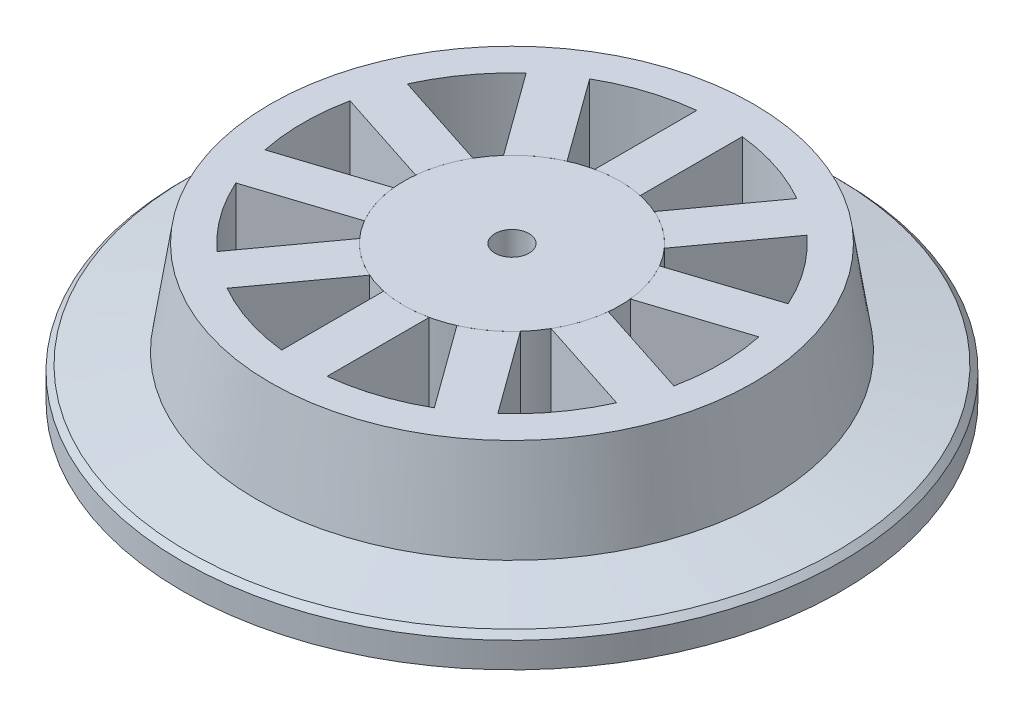
from build123d import *

# Parameters (mm, degrees)
SKETCH_4_R               = 11.6
SKETCH_4_R_2             = 0.6
EXTRUDE_1_DEPTH          = 1.1
EXTRUDE_START            = 1.5
SKETCH_4_3_R             = 9
SKETCH_4_3_R_2           = 0.6
EXTRUDE_2_DEPTH          = 3.3
CHAMFER_1_SIZE           = 0.2
SKETCH_4_4_R             = 0.6
CUT_EXTRUDE_2_DEPTH      = 18.092688495
CHAMFER_2_SIZE           = 0.5
CHAMFER_2_SIZE_2         = 3.3
CUT_EXTRUDE_4_DEPTH      = 18.092688495
EXTRUDE_3_DEPTH          = 4.8
PATTERN_CIRCULAR_2_COUNT = 10


with BuildPart() as part:
    # 草图4 → 凸台-拉伸1 (new body)
    with BuildSketch(Plane(origin=(0, 0, 0), x_dir=(1, 0, 0), z_dir=(0, 1, 0))):
        with Locations(Location((0, 0, 0), (0, 0, 270))):
            Circle(SKETCH_4_R)
        with Locations(Location((0, 0, 0), (0, 0, 270))):
            Circle(SKETCH_4_R_2, mode=Mode.SUBTRACT)
    extrude(amount=EXTRUDE_1_DEPTH)

    # 倒角1
    chamfer_1_edges = [part.edges().sort_by_distance(p)[0] for p in [
        (0, 1.1, -11.6),
    ]]
    chamfer(chamfer_1_edges, length=CHAMFER_1_SIZE)


with BuildPart() as body_2:
    # 草图4<3> → 凸台-拉伸2 (new body)
    with BuildSketch(Plane(origin=(0, 0, 0), x_dir=(1, 0, 0), z_dir=(0, 1, 0)).offset(EXTRUDE_START)):
        with Locations(Location((0, 0, 0), (0, 0, 270))):
            Circle(SKETCH_4_3_R)
        with Locations(Location((0, 0, 0), (0, 0, 270))):
            Circle(SKETCH_4_3_R_2, mode=Mode.SUBTRACT)
    extrude(amount=EXTRUDE_2_DEPTH)


    add(part.part)  # loft_1 joins it to this body
    # loft up to a face of the part (loft_1)
    loft([Face(Wire([body_2.edges().sort_by_distance((-6.560717647, 1.5, -6.160923953))[0]])), Face(Wire([body_2.edges().sort_by_distance((8.310242353, 1.1, -7.803837008))[0]]))])

    # 草图4<4> → 切除-拉伸2 (cut, through all)
    with BuildSketch(Plane(origin=(0, 0, 0), x_dir=(1, 0, 0), z_dir=(0, 1, 0))):
        with Locations(Location((0, 0, 0), (0, 0, 270))):
            Circle(SKETCH_4_4_R)
    extrude(amount=CUT_EXTRUDE_2_DEPTH, mode=Mode.SUBTRACT)

    # 倒角2
    # the kernel refuses this chamfer: 3.3, 0.5 mm, written as the material it takes off along each edge
    with BuildSketch(Plane(origin=(0, 4.8, 0), x_dir=(0, 0, 1), z_dir=(-1, 0, 0))) as chamfer_2_piece_1:
        Polygon((9 - CHAMFER_2_SIZE, 0), (9, -CHAMFER_2_SIZE_2), (9, 0), align=None)
    revolve(axis=Axis((0, 4.8, 0), (0, 1, 0)), mode=Mode.SUBTRACT)

    # 草图5 → 切除-拉伸4 (cut, through all)
    with BuildSketch(Plane(origin=(0, 4.8, 0), x_dir=(1, 0, 0), z_dir=(0, 1, 0))):
        with BuildLine():
            ThreePointArc((3.8, 0), (-2.387467277, -2.9563491), (-0.8, 3.714835124))
            Line((-0.8, 3.714835124), (-0.8, 7.30633287))
            ThreePointArc((-0.8, 7.30633287), (-4.906246019, -5.47277352), (7.35, 0))
            ThreePointArc((7.35, 0), (5.47277352, 4.906246019), (0.8, 7.30633287))
            Line((0.8, 7.30633287), (0.8, 3.714835124))
            ThreePointArc((0.8, 3.714835124), (2.9563491, 2.387467277), (3.8, 0))
        make_face()
        with BuildLine():
            Line((-0.8, 7.30633287), (-0.8, 3.714835124))
            ThreePointArc((-0.8, 3.714835124), (-0.402260194, 3.778648798), (0, 3.8))
            Line((0, 3.8), (0, 7.35))
            ThreePointArc((0, 7.35), (-0.400595438, 7.339075098), (-0.8, 7.30633287))
        make_face()
        with BuildLine():
            Line((0, 7.35), (0, 3.8))
            ThreePointArc((0, 3.8), (0.402260194, 3.778648798), (0.8, 3.714835124))
            Line((0.8, 3.714835124), (0.8, 7.30633287))
            ThreePointArc((0.8, 7.30633287), (0.400595438, 7.339075098), (0, 7.35))
        make_face()
    extrude(amount=-CUT_EXTRUDE_4_DEPTH, mode=Mode.SUBTRACT)


with BuildPart() as cut_extrude_4_piece_1:
    # of the separate pieces the step leaves, piece 1, a body of its own (cut_extrude_4_pieces)
    add(body_2.part.solids().sort_by_distance((0, 0.9, 11.6))[0])

    # 草图5<4> → 凸台-拉伸3 (add)
    with BuildSketch(Plane(origin=(0, 4.8, 0), x_dir=(1, 0, 0), z_dir=(0, 1, 0))):
        with BuildLine():
            Line((0, 7.35), (0, 3.8))
            ThreePointArc((0, 3.8), (0.402260194, 3.778648798), (0.8, 3.714835124))
            Line((0.8, 3.714835124), (0.8, 7.30633287))
            ThreePointArc((0.8, 7.30633287), (0.400595438, 7.339075098), (0, 7.35))
        make_face()
        with BuildLine():
            Line((-0.8, 7.30633287), (-0.8, 3.714835124))
            ThreePointArc((-0.8, 3.714835124), (-0.402260194, 3.778648798), (0, 3.8))
            Line((0, 3.8), (0, 7.35))
            ThreePointArc((0, 7.35), (-0.400595438, 7.339075098), (-0.8, 7.30633287))
        make_face()
    extrude_3 = extrude(amount=-EXTRUDE_3_DEPTH)

    # 阵列(圆周)2: 凸台-拉伸3 ×10 about axis
    pattern_circular_2_axis = Axis((0, 0, 0), (0, 1, 0))
    for i in range(1, PATTERN_CIRCULAR_2_COUNT):
        add(extrude_3.rotate(pattern_circular_2_axis, i * 360 / PATTERN_CIRCULAR_2_COUNT))


with BuildPart() as cut_extrude_4_piece_2:
    # of the separate pieces the step leaves, piece 2, a body of its own (cut_extrude_4_pieces)
    add(body_2.part.solids().sort_by_distance((-0.8, 0, -3.714835124))[0])


solid = Compound([cut_extrude_4_piece_1.part, cut_extrude_4_piece_2.part])
